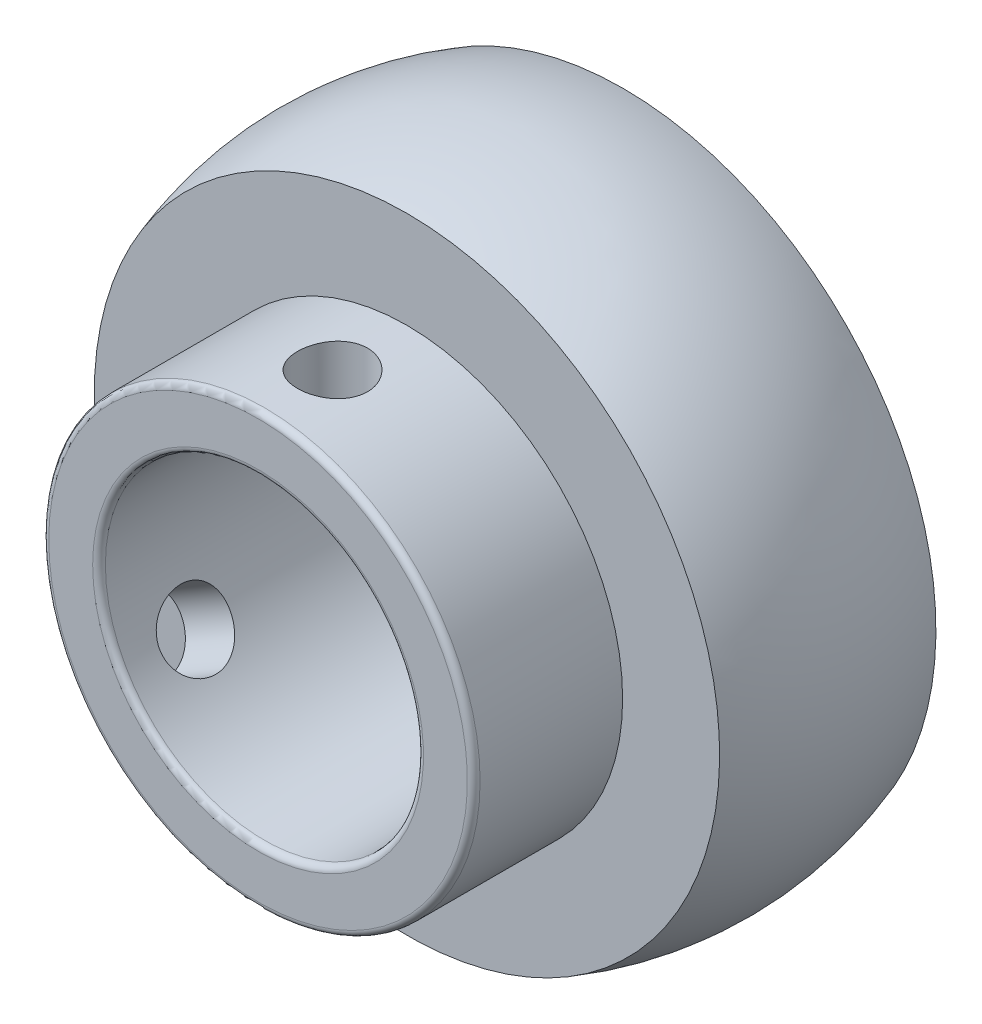
from build123d import *

# Parameters (mm, degrees)
SKETCH_2_R          = 2.75
CUT_EXTRUDE_1_DEPTH = 44.107423955
SKETCH_3_R          = 2.75
CUT_EXTRUDE_2_DEPTH = 44.107424007
FILLET_1_R          = 0.5


with BuildPart() as part:
    # Эскиз1 → Повернуть1 (revolve)
    with BuildSketch(Plane(origin=(0, 0, 0), x_dir=(0, 0, -1), z_dir=(1, 0, 0))):
        with BuildLine():
            Line((17, 16.95), (22.5, 16.95))
            Line((22.5, 16.95), (22.5, 12.5))
            Line((22.5, 12.5), (-11.7, 12.5))
            Line((-11.7, 12.5), (-11.7, 16.95))
            Line((-11.7, 16.95), (0, 16.95))
            Line((0, 16.95), (0, 24.571324751))
            ThreePointArc((0, 24.571324751), (8.5, 26), (17, 24.571324751))
            Line((17, 24.571324751), (17, 16.95))
        make_face()
    revolve(axis=Axis((0, 0, 1108.809062344), (0, 0, -1)))

    # Эскиз2 → Вырез-Вытянуть1 (cut, through all)
    with BuildSketch(Plane(origin=(0, 0, 0), x_dir=(1, 0, 0), z_dir=(0, 1, 0))):
        with Locations((0, -5.85)):
            Circle(SKETCH_2_R)
    extrude(amount=CUT_EXTRUDE_1_DEPTH, mode=Mode.SUBTRACT)

    # Эскиз3 → Вырез-Вытянуть2 (cut, through all)
    with BuildSketch(Plane(origin=(0, 0, 0), x_dir=(0, 0, -1), z_dir=(0.8660254037844398, 0.499999999999998, 0))):
        with Locations((-5.85, 0)):
            Circle(SKETCH_3_R)
    extrude(amount=-CUT_EXTRUDE_2_DEPTH, mode=Mode.SUBTRACT)

    # Скругление1
    fillet_1_edges = [part.edges().sort_by_distance(p)[0] for p in [
        (0, -12.5, -22.5),
        (0, -16.95, -22.5),
        (0, -12.5, 11.7),
        (0, -16.95, 11.7),
    ]]
    fillet(fillet_1_edges, radius=FILLET_1_R)


solid = part.part
